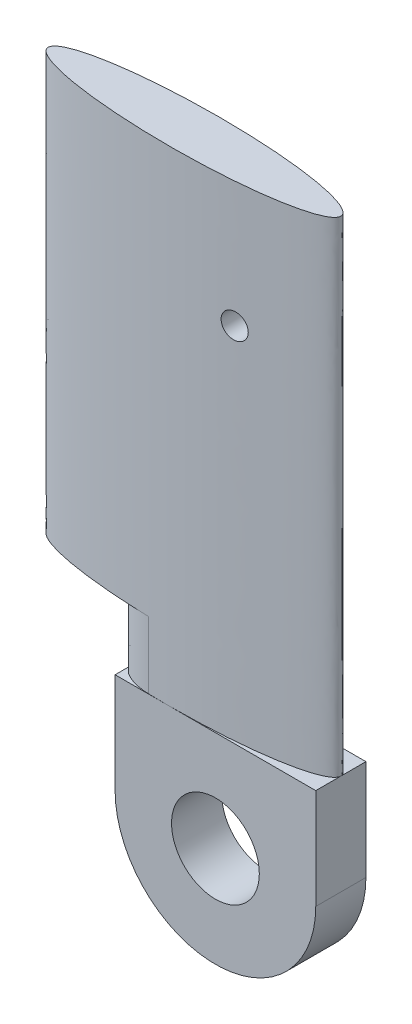
from build123d import *

# Parameters (mm, degrees)
SKETCH1_R           = 6
SKETCH1_R_2         = 2.625
BOSS_EXTRUDE1_DEPTH = 3
VARFILLET1_START    = 9
VARFILLET1_DEPTH    = 27
SKETCH3_R           = 0.75
CUT_EXTRUDE1_DEPTH  = 10
CUT_EXTRUDE2_DEPTH  = 29


with BuildPart() as part:
    # Sketch1 → Boss-Extrude1 (new body)
    # profile 1 of 2: a face of its own
    with BuildSketch(Plane.XY):
        Circle(SKETCH1_R)
        Circle(SKETCH1_R_2, mode=Mode.SUBTRACT)
    # profile 2 of 2: a face of its own
    with BuildSketch(Plane.XY):
        with BuildLine():
            ThreePointArc((-6, 0), (0, 6), (6, 0))
            Line((6, 0), (6, 35))
            Line((6, 35), (-11.5, 35))
            Line((-11.5, 35), (-11.5, 10))
            Line((-11.5, 10), (-6, 10))
            Line((-6, 10), (-6, 0))
        make_face()
    extrude(amount=BOSS_EXTRUDE1_DEPTH)

    # VarFillet1: read off the stored shape, not the designer's step
    # VarFillet1 outline → VarFillet1 (cut)
    with BuildSketch(Plane(origin=(0, 0, 0), x_dir=(1, 0, 0), z_dir=(0, 1, 0)).offset(VARFILLET1_START)):
        with BuildLine():
            Line((-11.5, 0), (-11.5, -1))
            add(Edge.make_bspline(
                [(-11.5, -1), (-11.5, 0), (-10.5, 0)],
                knots=[0, 0, 0, 1, 1, 1], degree=2, weights=[1, 0.707106781, 1]))
            Line((-10.5, 0), (-11.5, 0))
        make_face()
        with BuildLine():
            add(Edge.make_bspline(
                [(-10.5, -3), (-11.5, -3), (-11.5, -2)],
                knots=[0, 0, 0, 1, 1, 1], degree=2, weights=[1, 0.707106781, 1]))
            Line((-11.5, -2), (-11.5, -3))
            Line((-11.5, -3), (-10.5, -3))
        make_face()
    extrude(amount=VARFILLET1_DEPTH, mode=Mode.SUBTRACT)

    # Sketch3 → Cut-Extrude1 (cut)
    with BuildSketch(Plane(origin=(0, 0, 0), x_dir=(-1, 0, 0), z_dir=(0, 0, -1))):
        with Locations((-1, 27.5)):
            Circle(SKETCH3_R)
    extrude(amount=-CUT_EXTRUDE1_DEPTH, mode=Mode.SUBTRACT)

    # Sketch4 → Cut-Extrude2 (cut)
    with BuildSketch(Plane(origin=(0, 35, 0), x_dir=(1, 0, 0), z_dir=(0, 1, 0))):
        with BuildLine():
            add(Edge.make_bspline(
                [(-11.5, -1.5), (-11.5, -3), (-2.75, -3)],
                knots=[3.141592654, 3.141592654, 3.141592654, 4.71238898, 4.71238898, 4.71238898], degree=2, weights=[1, 0.707106781, 1]))
            Line((-11.5, -1.5), (-11.5, -2))
            add(Edge.make_bspline(
                [(-11.5, -2), (-11.5, -2.044212572), (-11.497556634, -2.088763387), (-11.492594945, -2.133427575), (-11.485078431, -2.177973981), (-11.467834671, -2.25365111), (-11.459364303, -2.284957301), (-11.449598731, -2.315998367), (-11.438548482, -2.346690105), (-11.396383093, -2.450298175), (-11.359098458, -2.521115675), (-11.314678332, -2.588201423), (-11.2637227, -2.650490863), (-11.167002152, -2.74721141), (-11.124052983, -2.784473941), (-11.078567587, -2.81858634), (-11.030904457, -2.849306994), (-10.961108173, -2.887647829), (-10.940450447, -2.898226324), (-10.919518964, -2.908189398), (-10.898342227, -2.917527611), (-10.846690105, -2.938548482), (-10.815998367, -2.949598731), (-10.784957301, -2.959364303), (-10.75365111, -2.967834671), (-10.677973981, -2.985078431), (-10.633427575, -2.992594945), (-10.588763387, -2.997556634), (-10.544212572, -3), (-10.5, -3)],
                knots=[0, 0, 0, 0, 0, 0, 0.145365954, 0.145365954, 0.145365954, 0.145365954, 0.248938267, 0.248938267, 0.248938267, 0.248938267, 0.499997344, 0.499997344, 0.499997344, 0.499997344, 0.677838335, 0.677838335, 0.677838335, 0.677838335, 0.751061743, 0.751061743, 0.751061743, 0.751061743, 0.854634052, 0.854634052, 0.854634052, 0.854634052, 1, 1, 1, 1, 1, 1], degree=5))
            Line((-10.5, -3), (-2.75, -3))
        make_face()
        with BuildLine():
            add(Edge.make_bspline(
                [(-2.75, 0), (-11.5, 0), (-11.5, -1.5)],
                knots=[1.570796327, 1.570796327, 1.570796327, 3.141592654, 3.141592654, 3.141592654], degree=2, weights=[1, 0.707106781, 1]))
            Line((-2.75, 0), (-10.5, 0))
            add(Edge.make_bspline(
                [(-10.5, 0), (-10.544212572, 0), (-10.588763387, -0.002443366), (-10.633427575, -0.007405055), (-10.677973981, -0.014921569), (-10.75365111, -0.032165329), (-10.784957301, -0.040635697), (-10.815998367, -0.050401269), (-10.846690105, -0.061451518), (-10.898342227, -0.082472389), (-10.919518964, -0.091810602), (-10.940450447, -0.101773676), (-10.961108173, -0.112352171), (-11.030904457, -0.150693006), (-11.078567587, -0.18141366), (-11.124052983, -0.215526059), (-11.167002152, -0.25278859), (-11.2637227, -0.349509137), (-11.314678332, -0.411798577), (-11.359098458, -0.478884325), (-11.396383093, -0.549701825), (-11.438548482, -0.653309895), (-11.449598731, -0.684001633), (-11.459364303, -0.715042699), (-11.467834671, -0.74634889), (-11.485078431, -0.822026019), (-11.492594945, -0.866572425), (-11.497556634, -0.911236613), (-11.5, -0.955787428), (-11.5, -1)],
                knots=[0, 0, 0, 0, 0, 0, 0.145365948, 0.145365948, 0.145365948, 0.145365948, 0.248938257, 0.248938257, 0.248938257, 0.248938257, 0.322161665, 0.322161665, 0.322161665, 0.322161665, 0.500002656, 0.500002656, 0.500002656, 0.500002656, 0.751061733, 0.751061733, 0.751061733, 0.751061733, 0.854634046, 0.854634046, 0.854634046, 0.854634046, 1, 1, 1, 1, 1, 1], degree=5))
            Line((-11.5, -1), (-11.5, -1.5))
        make_face()
        with BuildLine():
            Line((6, -1.5), (6, 0))
            Line((6, 0), (-2.75, 0))
            add(Edge.make_bspline(
                [(6, -1.5), (6, 0), (-2.75, 0)],
                knots=[0, 0, 0, 1.570796327, 1.570796327, 1.570796327], degree=2, weights=[1, 0.707106781, 1]))
        make_face()
        with BuildLine():
            Line((6, -3), (6, -1.5))
            add(Edge.make_bspline(
                [(-2.75, -3), (6, -3), (6, -1.5)],
                knots=[4.71238898, 4.71238898, 4.71238898, 6.283185307, 6.283185307, 6.283185307], degree=2, weights=[1, 0.707106781, 1]))
            Line((-2.75, -3), (6, -3))
        make_face()
    extrude(amount=-CUT_EXTRUDE2_DEPTH, mode=Mode.SUBTRACT)

    # Fillet1
    # a fillet whose section is not a circle: 2, 1 mm, written as the material it takes off along each edge (its section moved 0.00015 mm through the faces so that the kernel can cut it)
    with BuildSketch(Plane(origin=(-6, 6, 2.892692298), x_dir=(0.998929627958875, 0, 0.04625579299875686), z_dir=(0, 1, 0))) as fillet1_piece_1:
        with BuildLine():
            Bezier((1.976866185, 0), (0.001772887, -0.041529711), (-0.042168126, 0.907410455), weights=[1, 0.715976959, 1])
            Line((-0.042168126, 0.907410455), (-0.082125311, 0.905560223))
            ThreePointArc((-0.082125311, 0.905560223), (-0.060966328, 0.451858465), (-0.039957185, -0.001850232))
            Line((-0.039957185, -0.001850232), (-0.000887928, -0.039990144))
            ThreePointArc((-0.000887928, -0.039990144), (0.988453528, -0.050558307), (1.977707067, -0.03999116))
            Line((1.977707067, -0.03999116), (1.976866185, 0))
        make_face()
    extrude(amount=4, mode=Mode.SUBTRACT)
    with BuildSketch(Plane(origin=(-6, 6, 0.107307702), x_dir=(0.998929627958875, 0, -0.04625579299875679), z_dir=(0, 1, 0))) as fillet1_piece_2:
        with BuildLine():
            Bezier((1.976866185, 0), (0.001772887, 0.041529711), (-0.042168126, -0.907410455), weights=[1, 0.715976959, 1])
            Line((-0.042168126, -0.907410455), (-0.082125311, -0.905560223))
            ThreePointArc((-0.082125311, -0.905560223), (-0.060966328, -0.451858465), (-0.039957185, 0.001850232))
            Line((-0.039957185, 0.001850232), (-0.000887928, 0.039990144))
            ThreePointArc((-0.000887928, 0.039990144), (0.988453528, 0.050558307), (1.977707067, 0.03999116))
            Line((1.977707067, 0.03999116), (1.976866185, 0))
        make_face()
    extrude(amount=4, mode=Mode.SUBTRACT)


solid = part.part
